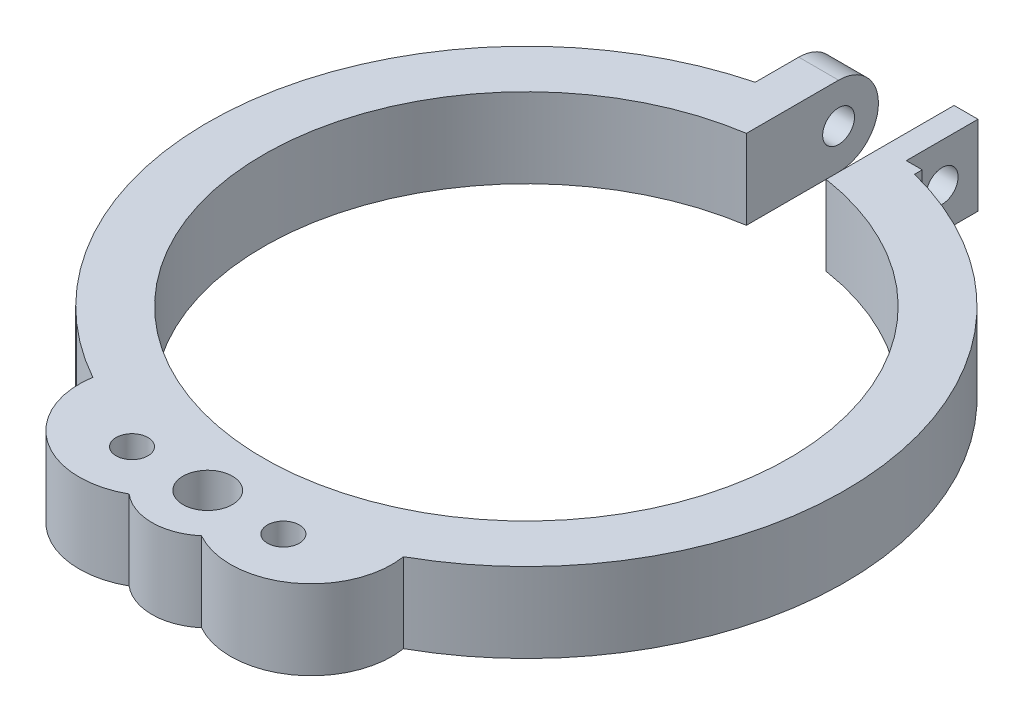
from build123d import *

# Parameters (mm, degrees)
SALIENTE_EXTRUIR1_DEPTH = 10
SALIENTE_EXTRUIR2_START = -10
SALIENTE_EXTRUIR2_DEPTH = 10
CROQUIS3_R              = 2
SALIENTE_EXTRUIR3_DEPTH = 5
CROQUIS5_W              = 9
CROQUIS5_H              = 10
CROQUIS5_R              = 2
SALIENTE_EXTRUIR4_DEPTH = 3
CROQUIS8_R              = 2
CORTAR_EXTRUIR1_DEPTH   = 10
CROQUIS10_R             = 3.1
CORTAR_EXTRUIR3_DEPTH   = 10


with BuildPart() as part:
    # Croquis1 → Saliente-Extruir1 (new body)
    with BuildSketch(Plane(origin=(0, 0, 0), x_dir=(1, 0, 0), z_dir=(0, 1, 0))):
        with BuildLine():
            Line((5, 39.686269666), (5, 32.619012861))
            ThreePointArc((5, 32.619012861), (0, -33), (-5, 32.619012861))
            Line((-5, 32.619012861), (-5, 39.686269666))
            Line((-5, 39.686269666), (-10, 39.686269666))
            Line((-10, 39.686269666), (-10, 38.729833462))
            ThreePointArc((-10, 38.729833462), (0, -40), (10, 38.729833462))
            Line((10, 38.729833462), (10, 39.686269666))
            Line((10, 39.686269666), (5, 39.686269666))
        make_face()
    extrude(amount=SALIENTE_EXTRUIR1_DEPTH)

    # Croquis2 → Saliente-Extruir2 (add)
    with BuildSketch(Plane(origin=(0, 10, 0), x_dir=(1, 0, 0), z_dir=(0, 1, 0)).offset(SALIENTE_EXTRUIR2_START)):
        with BuildLine():
            ThreePointArc((-19.500878735, -34.924428822), (-15.280033507, -44.812112406), (-4.541463415, -45.326829268))
            ThreePointArc((-4.541463415, -45.326829268), (0, -47), (4.541463415, -45.326829268))
            ThreePointArc((4.541463415, -45.326829268), (15.280033507, -44.812112406), (19.500878735, -34.924428822))
            ThreePointArc((19.500878735, -34.924428822), (0, -40), (-19.500878735, -34.924428822))
        make_face()
    extrude(amount=SALIENTE_EXTRUIR2_DEPTH)

    # Croquis3 → Saliente-Extruir3 (add)
    with BuildSketch(Plane.ZY.offset(10)):
        with BuildLine():
            Line((-39.686269666, 10), (-44.186269666, 10))
            ThreePointArc((-44.186269666, 10), (-49.186269666, 5), (-44.186269666, 0))
            Line((-44.186269666, 0), (-39.686269666, 0))
            Line((-39.686269666, 0), (-39.686269666, 10))
        make_face()
        with Locations((-44.186269666, 5)):
            Circle(CROQUIS3_R, mode=Mode.SUBTRACT)
    extrude(amount=-SALIENTE_EXTRUIR3_DEPTH)

    # Croquis5 → Saliente-Extruir4 (add)
    with BuildSketch(Plane.ZY.offset(-5)):
        with Locations((-44.186269666, 5)):
            Rectangle(CROQUIS5_W, CROQUIS5_H)
        with Locations((-44.186269666, 5)):
            Circle(CROQUIS5_R, mode=Mode.SUBTRACT)
    extrude(amount=-SALIENTE_EXTRUIR4_DEPTH)

    # Croquis8 → Cortar-Extruir1 (cut)
    with BuildSketch(Plane(origin=(0, 10, 0), x_dir=(1, 0, 0), z_dir=(0, 1, 0))):
        with Locations((9.5, -40)):
            Circle(CROQUIS8_R)
        with Locations((-9.5, -40)):
            Circle(CROQUIS8_R)
    extrude(amount=-CORTAR_EXTRUIR1_DEPTH, mode=Mode.SUBTRACT)

    # Croquis10 → Cortar-Extruir3 (cut)
    with BuildSketch(Plane(origin=(0, 10, 0), x_dir=(1, 0, 0), z_dir=(0, 1, 0))):
        with Locations((0, -40)):
            Circle(CROQUIS10_R)
    extrude(amount=-CORTAR_EXTRUIR3_DEPTH, mode=Mode.SUBTRACT)


solid = part.part
